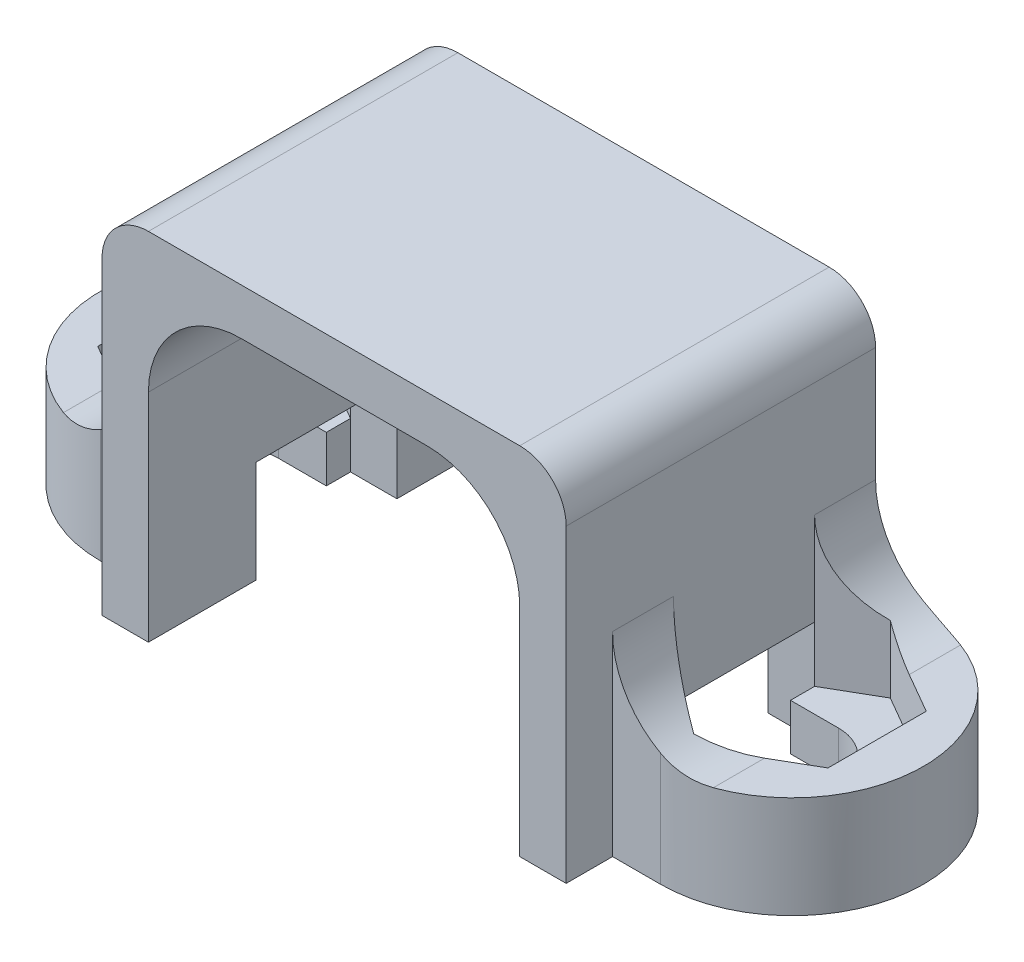
from build123d import *

# Parameters (mm, degrees)
BOSS_EXTRUDE1_DEPTH = 5
CUT_EXTRUDE1_REACH  = 18.405
CUT_EXTRUDE2_DEPTH  = 1.8
FILLET1_START       = -5
FILLET1_DEPTH       = 10
FILLET1_2_DEPTH     = 1.969466537
FILLET1_START_2     = 1.530533463
FILLET1_3_DEPTH     = 1.969466537
FILLET1_START_3     = 3.3
FILLET1_4_DEPTH     = 3.7
FILLET2_R           = 1.5
CUT_EXTRUDE3_DEPTH  = 3
CUT_EXTRUDE4_REACH  = 20.279
SKETCH5_W           = 15
SKETCH5_H           = 4.561067126


with BuildPart() as part:
    # Sketch1 → Boss-Extrude1 (new, symmetric)
    with BuildSketch(Plane.XY):
        Polygon((-7.5, 11.5), (7.5, 11.5), (7.5, 3.3), (13.3, 3.3), (13.3, 0), (6, 0), (6, 10), (-6, 10), (-6, 0), (-13.3, 0), (-13.3, 3.3), (-7.5, 3.3), align=None)
    extrude(amount=BOSS_EXTRUDE1_DEPTH, both=True)

    # Sketch2 → Cut-Extrude1 (cut, up to next)
    with BuildSketch(Plane(origin=(0, 3.3, 0), x_dir=(1, 0, 0), z_dir=(0, 1, 0)), mode=Mode.PRIVATE) as cut_extrude1_sk1:
        with BuildLine():
            ThreePointArc((-9.05, -3.5), (-12.05520382, -2.25520382), (-13.3, 0.75))
            Line((-13.3, 0.75), (-13.3, -5))
            Line((-13.3, -5), (-7.5, -5))
            Line((-7.5, -5), (-7.5, -3.5))
            Line((-7.5, -3.5), (-9.05, -3.5))
        make_face()
    cut_extrude1_tool1 = extrude(cut_extrude1_sk1.sketch, amount=-CUT_EXTRUDE1_REACH, mode=Mode.PRIVATE) & part.part
    # Sketch2 → Cut-Extrude1 (cut, up to next)
    with BuildSketch(Plane(origin=(0, 3.3, 0), x_dir=(1, 0, 0), z_dir=(0, 1, 0)), mode=Mode.PRIVATE) as cut_extrude1_sk2:
        with BuildLine():
            ThreePointArc((-13.3, 0.75), (-12.05520382, 3.75520382), (-9.05, 5))
            Line((-9.05, 5), (-13.3, 5))
            Line((-13.3, 5), (-13.3, 0.75))
        make_face()
    cut_extrude1_tool2 = extrude(cut_extrude1_sk2.sketch, amount=-CUT_EXTRUDE1_REACH, mode=Mode.PRIVATE) & part.part
    # Sketch2 → Cut-Extrude1 (cut, up to next)
    with BuildSketch(Plane(origin=(0, 3.3, 0), x_dir=(1, 0, 0), z_dir=(0, 1, 0)), mode=Mode.PRIVATE) as cut_extrude1_sk3:
        with BuildLine():
            ThreePointArc((9.05, 5), (12.05520382, 3.75520382), (13.3, 0.75))
            Line((13.3, 0.75), (13.3, 5))
            Line((13.3, 5), (9.05, 5))
        make_face()
    cut_extrude1_tool3 = extrude(cut_extrude1_sk3.sketch, amount=-CUT_EXTRUDE1_REACH, mode=Mode.PRIVATE) & part.part
    # Sketch2 → Cut-Extrude1 (cut, up to next)
    with BuildSketch(Plane(origin=(0, 3.3, 0), x_dir=(1, 0, 0), z_dir=(0, 1, 0)), mode=Mode.PRIVATE) as cut_extrude1_sk4:
        with BuildLine():
            ThreePointArc((13.3, 0.75), (12.05520382, -2.25520382), (9.05, -3.5))
            Line((9.05, -3.5), (7.5, -3.5))
            Line((7.5, -3.5), (7.5, -5))
            Line((7.5, -5), (13.3, -5))
            Line((13.3, -5), (13.3, 0.75))
        make_face()
    cut_extrude1_tool4 = extrude(cut_extrude1_sk4.sketch, amount=-CUT_EXTRUDE1_REACH, mode=Mode.PRIVATE) & part.part
    add(cut_extrude1_tool1.solids().sort_by_distance((-11.00124, 3.3, 3.726238))[0], mode=Mode.SUBTRACT)
    add(cut_extrude1_tool2.solids().sort_by_distance((-12.350686, 3.3, -4.050686))[0], mode=Mode.SUBTRACT)
    add(cut_extrude1_tool3.solids().sort_by_distance((12.350686, 3.3, -4.050686))[0], mode=Mode.SUBTRACT)
    add(cut_extrude1_tool4.solids().sort_by_distance((11.00124, 3.3, 3.726238))[0], mode=Mode.SUBTRACT)

    # Sketch3 → Cut-Extrude2 (cut)
    with BuildSketch(Plane(origin=(0, 3.3, 0), x_dir=(1, 0, 0), z_dir=(0, 1, 0))):
        Polygon((-9.05, 3.925426481), (-11.8, 2.33771324), (-11.8, -0.83771324), (-9.05, -2.425426481), (-6.3, -0.83771324), (-6.3, 2.33771324), align=None)
        Polygon((9.05, 3.925426481), (6.3, 2.33771324), (6.3, -0.83771324), (9.05, -2.425426481), (11.8, -0.83771324), (11.8, 2.33771324), align=None)
    extrude(amount=-CUT_EXTRUDE2_DEPTH, mode=Mode.SUBTRACT)

    # Fillet1: read off the stored shape, not the designer's step
    # Fillet1 outline → Fillet1 (add)
    with BuildSketch(Plane.XY.offset(FILLET1_START)):
        with BuildLine():
            ThreePointArc((-6, 7), (-5.121320344, 9.121320344), (-3, 10))
            Line((-3, 10), (-6, 10))
            Line((-6, 10), (-6, 7))
        make_face()
        with BuildLine():
            ThreePointArc((3, 10), (5.121320344, 9.121320344), (6, 7))
            Line((6, 7), (6, 10))
            Line((6, 10), (3, 10))
        make_face()
    extrude(amount=FILLET1_DEPTH)

    # Fillet1 2 outline → Fillet1 2 (add)
    with BuildSketch(Plane.XY.offset(FILLET1_START)):
        with BuildLine():
            ThreePointArc((-7.5, 6.3), (-8.378679656, 4.178679656), (-10.5, 3.3))
            Line((-10.5, 3.3), (-7.5, 3.3))
            Line((-7.5, 3.3), (-7.5, 6.3))
        make_face()
        with BuildLine():
            ThreePointArc((10.5, 3.3), (8.378679656, 4.178679656), (7.5, 6.3))
            Line((7.5, 6.3), (7.5, 3.3))
            Line((7.5, 3.3), (10.5, 3.3))
        make_face()
    extrude(amount=FILLET1_2_DEPTH)

    # Fillet1 3 outline → Fillet1 3 (add)
    with BuildSketch(Plane.XY.offset(FILLET1_START_2)):
        with BuildLine():
            ThreePointArc((-7.5, 6.3), (-8.378679656, 4.178679656), (-10.5, 3.3))
            Line((-10.5, 3.3), (-7.5, 3.3))
            Line((-7.5, 3.3), (-7.5, 6.3))
        make_face()
        with BuildLine():
            ThreePointArc((10.5, 3.3), (8.378679656, 4.178679656), (7.5, 6.3))
            Line((7.5, 6.3), (7.5, 3.3))
            Line((7.5, 3.3), (10.5, 3.3))
        make_face()
    extrude(amount=FILLET1_3_DEPTH)

    # Fillet1 4 outline → Fillet1 4 (cut)
    with BuildSketch(Plane(origin=(0, 0, 0), x_dir=(1, 0, 0), z_dir=(0, 1, 0)).offset(FILLET1_START_3)):
        with BuildLine():
            ThreePointArc((10.5, -3.244996871), (9.786126109, -3.435763772), (9.05, -3.5))
            Line((9.05, -3.5), (10.5, -3.5))
            Line((10.5, -3.5), (10.5, -3.244996871))
        make_face()
        Polygon((9.05, 3.925426481), (7.5, 3.030533563), (10.5, 3.030533463), (10.5, 3.08826859), align=None)
        Polygon((10.5, -1.530533463), (7.5, -1.530533463), (9.05, -2.425426481), (10.5, -1.58826859), align=None)
        with BuildLine():
            Line((10.5, 5), (9.05, 5))
            ThreePointArc((9.05, 5), (9.786126109, 4.935763772), (10.5, 4.744996871))
            Line((10.5, 4.744996871), (10.5, 5))
        make_face()
        with BuildLine():
            ThreePointArc((-9.05, -3.5), (-9.786126109, -3.435763772), (-10.5, -3.244996871))
            Line((-10.5, -3.244996871), (-10.5, -3.5))
            Line((-10.5, -3.5), (-9.05, -3.5))
        make_face()
        Polygon((-9.05, 3.925426481), (-10.5, 3.08826859), (-10.5, 3.030533463), (-7.5, 3.030533463), align=None)
        Polygon((-7.5, -1.530533463), (-10.5, -1.530533463), (-10.5, -1.58826859), (-9.05, -2.425426481), align=None)
        with BuildLine():
            Line((-9.05, 5), (-10.5, 5))
            Line((-10.5, 5), (-10.5, 4.744996871))
            ThreePointArc((-10.5, 4.744996871), (-9.786126109, 4.935763772), (-9.05, 5))
        make_face()
    extrude(amount=FILLET1_4_DEPTH, mode=Mode.SUBTRACT)

    # Fillet2
    fillet2_edges = [part.edges().sort_by_distance(p)[0] for p in [
        (-7.5, 11.5, 0),
        (7.5, 11.5, 0),
    ]]
    fillet(fillet2_edges, radius=FILLET2_R)

    # Sketch4 → Cut-Extrude3 (cut)
    with BuildSketch(Plane(origin=(0, 0, 0), x_dir=(1, 0, 0), z_dir=(0, 1, 0))):
        with BuildLine():
            Line((-9.05, -0.75), (9.05, -0.75))
            ThreePointArc((9.05, -0.75), (10.55, 0.75), (9.05, 2.25))
            Line((9.05, 2.25), (-9.05, 2.25))
            ThreePointArc((-9.05, 2.25), (-10.55, 0.75), (-9.05, -0.75))
        make_face()
    extrude(amount=CUT_EXTRUDE3_DEPTH, mode=Mode.SUBTRACT)

    # Cut-Extrude4: up to this face of the body (flat: up to its plane)
    cut_extrude4_end = Plane(part.part.faces().sort_by_distance((6.935820896, 3.3, -0.75))[0])
    # Sketch5 → Cut-Extrude4 (cut, up to the picked face)
    with BuildSketch(Plane(origin=(0, 0, 0), x_dir=(1, 0, 0), z_dir=(0, 1, 0)), mode=Mode.PRIVATE) as cut_extrude4_sk1:
        with Locations((0, 0.75)):
            Rectangle(SKETCH5_W, SKETCH5_H)
    cut_extrude4_tool1 = split(extrude(cut_extrude4_sk1.sketch, amount=CUT_EXTRUDE4_REACH, mode=Mode.PRIVATE), bisect_by=cut_extrude4_end, keep=Keep.BOTH, mode=Mode.PRIVATE)
    add(cut_extrude4_tool1.solids().sort_by(Axis((0, 0, -0.75), (0, 1, 0)))[0], mode=Mode.SUBTRACT)


solid = part.part
